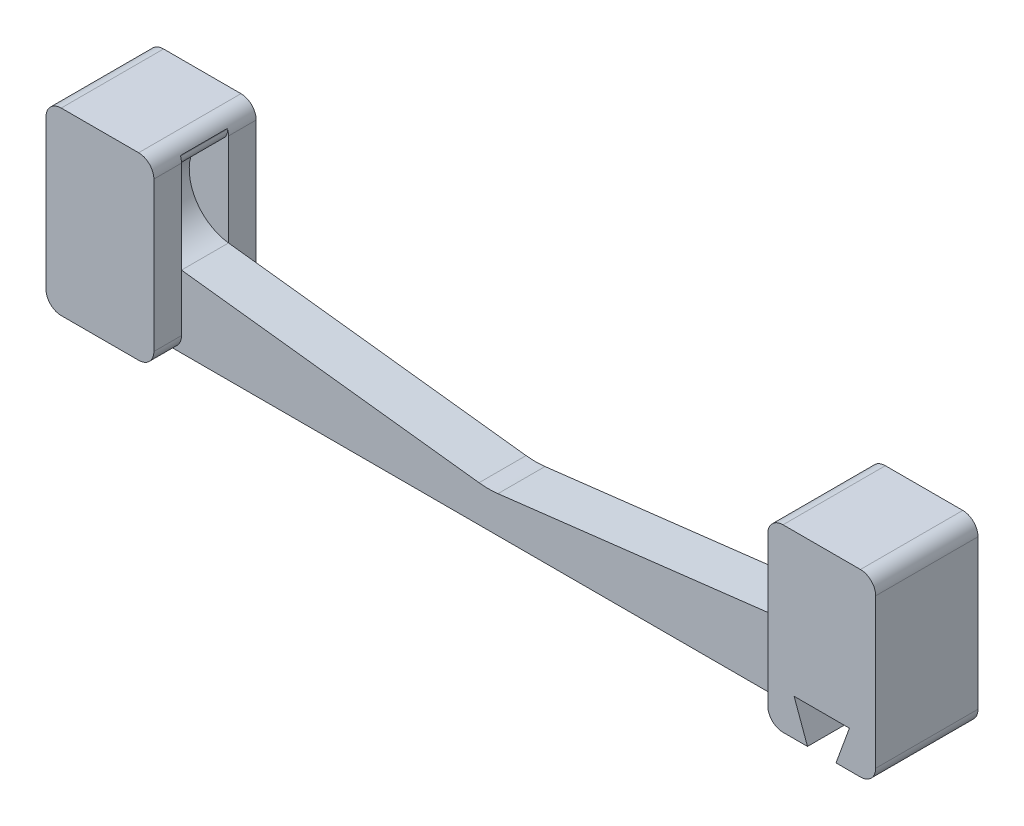
from build123d import *

# Parameters (mm, degrees)
SKETCH1_W               = 38.1
SKETCH1_H               = 2.159
BOSS_EXTRUDE1_DEPTH     = 8.255
CUT_EXTRUDE1_DEPTH      = 12.7
SKETCH3_W               = 4.953
SKETCH3_H               = 8.255
BOSS_EXTRUDE2_DEPTH     = 1.27
FILLET5_R               = 0.4826
MIRROR2_COPY_1_SKETCH_W = 4.953
MIRROR2_COPY_1_SKETCH_H = 8.255
MIRROR2_COPY_1_DEPTH    = 1.27
CUT_EXTRUDE2_DEPTH      = 22.286806422
FILLET6_R               = 0.6985


with BuildPart() as part:
    # Sketch1 → Boss-Extrude1 (new body)
    with BuildSketch(Plane(origin=(0, 0, 0), x_dir=(1, 0, 0), z_dir=(0, 1, 0))):
        Rectangle(SKETCH1_W, SKETCH1_H)
    extrude(amount=BOSS_EXTRUDE1_DEPTH)

    # Sketch2 → Cut-Extrude1 (cut)
    with BuildSketch(Plane.XY.offset(1.0795)):
        with BuildLine():
            ThreePointArc((-0.435059279, 1.676786249), (0, 1.651), (0.435059279, 1.676786249))
            Line((0.435059279, 1.676786249), (14.097, 3.302))
            ThreePointArc((14.097, 3.302), (15.901602081, 5.334), (14.097, 7.366))
            Line((14.097, 7.366), (14.202754743, 8.255))
            Line((14.202754743, 8.255), (-14.202754743, 8.255))
            Line((-14.202754743, 8.255), (-14.097, 7.366))
            ThreePointArc((-14.097, 7.366), (-15.901602081, 5.334), (-14.097, 3.302))
            Line((-14.097, 3.302), (-0.435059279, 1.676786249))
        make_face()
    extrude(amount=-CUT_EXTRUDE1_DEPTH, mode=Mode.SUBTRACT)

    # Sketch3 → Boss-Extrude2 (add)
    with BuildSketch(Plane.XY.offset(1.0795)):
        with Locations((-16.5735, 4.1275)):
            Rectangle(SKETCH3_W, SKETCH3_H)
    boss_extrude2 = extrude(amount=BOSS_EXTRUDE2_DEPTH)

    # Fillet5
    fillet5_edges = [part.edges().sort_by_distance(p)[0] for p in [
        (14.202754743, 8.255, 0),
        (-14.202754743, 8.255, 0),
        (14.097, 7.366, 0),
        (-14.097, 7.366, 0),
    ]]
    fillet(fillet5_edges, radius=FILLET5_R)

    # Mirror1: Boss-Extrude2 across plane
    add(boss_extrude2.mirror(Plane(origin=(0, 0, 0), x_dir=(0, 0, 1), z_dir=(1, 0, 0))))

    # Mirror2: Boss-Extrude2 across plane
    add(boss_extrude2.mirror(Plane.XY))

    # Mirror2 copy 1 sketch → Mirror2 copy 1 (add)
    with BuildSketch(Plane(origin=(0, 0, -1.0795), x_dir=(-1, 0, 0), z_dir=(0, 0, -1))):
        with Locations((-16.5735, 4.1275)):
            Rectangle(MIRROR2_COPY_1_SKETCH_W, MIRROR2_COPY_1_SKETCH_H)
    extrude(amount=MIRROR2_COPY_1_DEPTH)

    # Sketch4 → Cut-Extrude2 (cut, through all)
    with BuildSketch(Plane.XY.offset(2.3495)):
        Polygon((15.3035, 1.6891), (17.8435, 1.6891), (17.228717877, 0), (15.918282123, 0), align=None)
    extrude(amount=-CUT_EXTRUDE2_DEPTH, mode=Mode.SUBTRACT)

    # Fillet6
    # the kernel refuses this fillet: 0.6985 mm, written as the material it takes off along each edge
    with BuildSketch(Plane(origin=(-19.05, 8.255, -4.09575), x_dir=(1, 0, 0), z_dir=(0, 0, 1)), Plane(origin=(19.05, 8.255, 4.09575), x_dir=(-1, 0, 0), z_dir=(0, 0, -1)), Plane(origin=(-19.05, 0, 4.09575), x_dir=(1, 0, 0), z_dir=(0, 0, -1))) as fillet6_piece_1:
        with BuildLine():
            CenterArc((FILLET6_R, -FILLET6_R), FILLET6_R, 90, 90)
            Line((0, -FILLET6_R), (0, 0))
            Line((0, 0), (FILLET6_R, 0))
        make_face()
    extrude(amount=8.1915, mode=Mode.SUBTRACT)
    with BuildSketch(Plane(origin=(-14.097, 8.255, 0.66675), x_dir=(-1, 0, 0), z_dir=(0, 0, -1)), Plane(origin=(-14.097, 8.255, -0.66675), x_dir=(0, -1, 0), z_dir=(0, 0, 1))) as fillet6_piece_2:
        with BuildLine():
            CenterArc((FILLET6_R, -FILLET6_R), FILLET6_R, 90, 90)
            Line((0, -FILLET6_R), (0, 0))
            Line((0, 0), (FILLET6_R, 0))
        make_face()
    extrude(amount=4.7625, mode=Mode.SUBTRACT)
    with BuildSketch(Plane(origin=(-14.097, 0, -1.0795), x_dir=(-1, 0, 0), z_dir=(0, 0, -1)), Plane(origin=(-14.097, 0, 1.0795), x_dir=(0, 1, 0), z_dir=(0, 0, 1))) as fillet6_piece_3:
        with BuildLine():
            CenterArc((FILLET6_R, FILLET6_R), FILLET6_R, 180, 90)
            Line((0, FILLET6_R), (0, 0))
            Line((0, 0), (FILLET6_R, 0))
        make_face()
    extrude(amount=3.01625, mode=Mode.SUBTRACT)
    with BuildSketch(Plane(origin=(14.097, 0, -1.0795), x_dir=(1, 0, 0), z_dir=(0, 0, -1)), Plane(origin=(14.097, 0, 1.0795), x_dir=(0, 1, 0), z_dir=(0, 0, 1))) as fillet6_piece_4:
        with BuildLine():
            CenterArc((FILLET6_R, -FILLET6_R), FILLET6_R, 90, 90)
            Line((0, -FILLET6_R), (0, 0))
            Line((0, 0), (FILLET6_R, 0))
        make_face()
    extrude(amount=3.01625, mode=Mode.SUBTRACT)
    with BuildSketch(Plane(origin=(14.097, 8.255, 0.66675), x_dir=(1, 0, 0), z_dir=(0, 0, -1)), Plane(origin=(14.097, 8.255, -0.66675), x_dir=(0, -1, 0), z_dir=(0, 0, 1))) as fillet6_piece_5:
        with BuildLine():
            CenterArc((FILLET6_R, FILLET6_R), FILLET6_R, 180, 90)
            Line((0, FILLET6_R), (0, 0))
            Line((0, 0), (FILLET6_R, 0))
        make_face()
    extrude(amount=4.7625, mode=Mode.SUBTRACT)
    with BuildSketch(Plane(origin=(19.05, 0, -4.09575), x_dir=(0, 1, 0), z_dir=(0, 0, 1))) as fillet6_piece_6:
        with BuildLine():
            CenterArc((FILLET6_R, FILLET6_R), FILLET6_R, 180, 90)
            Line((0, FILLET6_R), (0, 0))
            Line((0, 0), (FILLET6_R, 0))
        make_face()
    extrude(amount=8.1915, mode=Mode.SUBTRACT)


solid = part.part
